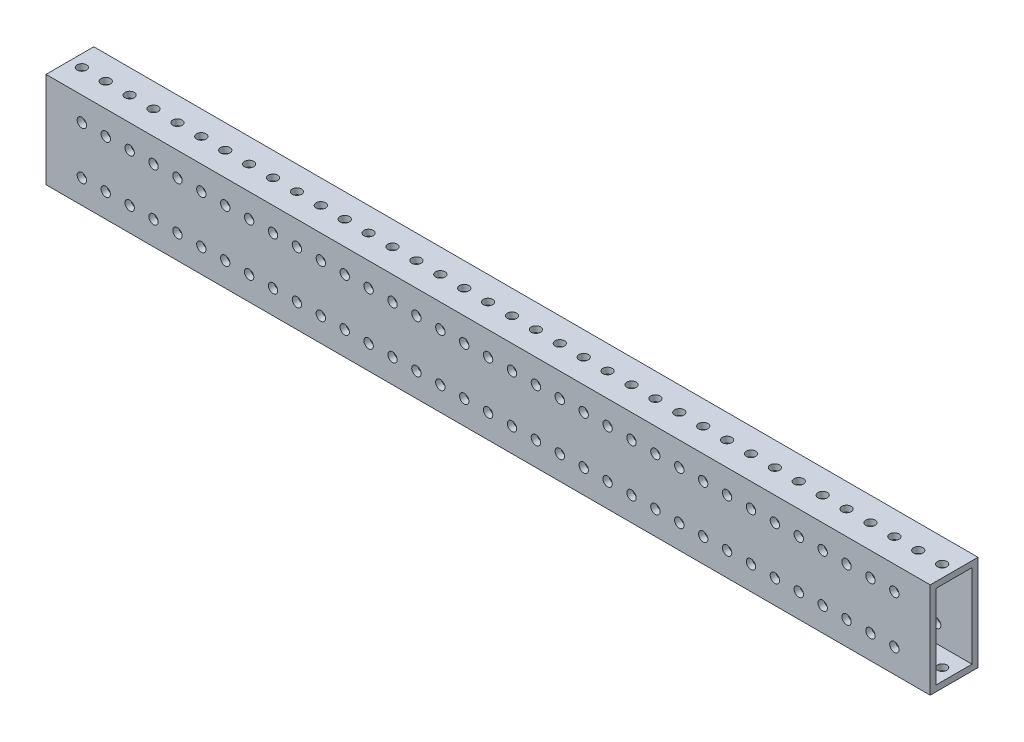
from build123d import *

# Parameters (mm, degrees)
SKETCH1_W           = 469.9
SKETCH1_H           = 50.8
BOSS_EXTRUDE1_DEPTH = 25.4
SHELL1_T            = -3.175
SKETCH2_R           = 2.4892
CUT_EXTRUDE1_DEPTH  = 25.4
SKETCH3_R           = 2.4892
CUT_EXTRUDE2_DEPTH  = 50.8


with BuildPart() as part:
    # Sketch1 → Boss-Extrude1 (new body)
    with BuildSketch(Plane.XY):
        with Locations((234.95, 25.4)):
            Rectangle(SKETCH1_W, SKETCH1_H)
    extrude(amount=BOSS_EXTRUDE1_DEPTH)

    # Shell1
    shell1_openings = [part.faces().sort_by_distance(p)[0] for p in [
        (469.9, 25.4, 12.7),
        (0, 25.4, 12.7),
    ]]
    offset(amount=SHELL1_T, openings=shell1_openings, kind=Kind.INTERSECTION)

    # Sketch2 → Cut-Extrude1 (cut)
    with BuildSketch(Plane(origin=(0, 0, 0), x_dir=(-1, 0, 0), z_dir=(0, 0, -1))):
        with Locations((-450.85, 38.1)):
            Circle(SKETCH2_R)
        with Locations((-438.15, 38.1)):
            Circle(SKETCH2_R)
        with Locations((-425.45, 38.1)):
            Circle(SKETCH2_R)
        with Locations((-412.75, 38.1)):
            Circle(SKETCH2_R)
        with Locations((-400.05, 38.1)):
            Circle(SKETCH2_R)
        with Locations((-387.35, 38.1)):
            Circle(SKETCH2_R)
        with Locations((-374.65, 38.1)):
            Circle(SKETCH2_R)
        with Locations((-361.95, 38.1)):
            Circle(SKETCH2_R)
        with Locations((-349.25, 38.1)):
            Circle(SKETCH2_R)
        with Locations((-336.55, 38.1)):
            Circle(SKETCH2_R)
        with Locations((-323.85, 38.1)):
            Circle(SKETCH2_R)
        with Locations((-311.15, 38.1)):
            Circle(SKETCH2_R)
        with Locations((-298.45, 38.1)):
            Circle(SKETCH2_R)
        with Locations((-285.75, 38.1)):
            Circle(SKETCH2_R)
        with Locations((-273.05, 38.1)):
            Circle(SKETCH2_R)
        with Locations((-260.35, 38.1)):
            Circle(SKETCH2_R)
        with Locations((-247.65, 38.1)):
            Circle(SKETCH2_R)
        with Locations((-234.95, 38.1)):
            Circle(SKETCH2_R)
        with Locations((-222.25, 38.1)):
            Circle(SKETCH2_R)
        with Locations((-209.55, 38.1)):
            Circle(SKETCH2_R)
        with Locations((-196.85, 38.1)):
            Circle(SKETCH2_R)
        with Locations((-184.15, 38.1)):
            Circle(SKETCH2_R)
        with Locations((-171.45, 38.1)):
            Circle(SKETCH2_R)
        with Locations((-158.75, 38.1)):
            Circle(SKETCH2_R)
        with Locations((-146.05, 38.1)):
            Circle(SKETCH2_R)
        with Locations((-133.35, 38.1)):
            Circle(SKETCH2_R)
        with Locations((-120.65, 38.1)):
            Circle(SKETCH2_R)
        with Locations((-107.95, 38.1)):
            Circle(SKETCH2_R)
        with Locations((-95.25, 38.1)):
            Circle(SKETCH2_R)
        with Locations((-82.55, 38.1)):
            Circle(SKETCH2_R)
        with Locations((-69.85, 38.1)):
            Circle(SKETCH2_R)
        with Locations((-57.15, 38.1)):
            Circle(SKETCH2_R)
        with Locations((-44.45, 38.1)):
            Circle(SKETCH2_R)
        with Locations((-31.75, 38.1)):
            Circle(SKETCH2_R)
        with Locations((-19.05, 38.1)):
            Circle(SKETCH2_R)
        with Locations((-438.15, 12.7)):
            Circle(SKETCH2_R)
        with Locations((-425.45, 12.7)):
            Circle(SKETCH2_R)
        with Locations((-412.75, 12.7)):
            Circle(SKETCH2_R)
        with Locations((-400.05, 12.7)):
            Circle(SKETCH2_R)
        with Locations((-387.35, 12.7)):
            Circle(SKETCH2_R)
        with Locations((-374.65, 12.7)):
            Circle(SKETCH2_R)
        with Locations((-361.95, 12.7)):
            Circle(SKETCH2_R)
        with Locations((-349.25, 12.7)):
            Circle(SKETCH2_R)
        with Locations((-336.55, 12.7)):
            Circle(SKETCH2_R)
        with Locations((-323.85, 12.7)):
            Circle(SKETCH2_R)
        with Locations((-311.15, 12.7)):
            Circle(SKETCH2_R)
        with Locations((-298.45, 12.7)):
            Circle(SKETCH2_R)
        with Locations((-285.75, 12.7)):
            Circle(SKETCH2_R)
        with Locations((-273.05, 12.7)):
            Circle(SKETCH2_R)
        with Locations((-260.35, 12.7)):
            Circle(SKETCH2_R)
        with Locations((-247.65, 12.7)):
            Circle(SKETCH2_R)
        with Locations((-234.95, 12.7)):
            Circle(SKETCH2_R)
        with Locations((-222.25, 12.7)):
            Circle(SKETCH2_R)
        with Locations((-209.55, 12.7)):
            Circle(SKETCH2_R)
        with Locations((-196.85, 12.7)):
            Circle(SKETCH2_R)
        with Locations((-184.15, 12.7)):
            Circle(SKETCH2_R)
        with Locations((-171.45, 12.7)):
            Circle(SKETCH2_R)
        with Locations((-158.75, 12.7)):
            Circle(SKETCH2_R)
        with Locations((-146.05, 12.7)):
            Circle(SKETCH2_R)
        with Locations((-133.35, 12.7)):
            Circle(SKETCH2_R)
        with Locations((-120.65, 12.7)):
            Circle(SKETCH2_R)
        with Locations((-107.95, 12.7)):
            Circle(SKETCH2_R)
        with Locations((-95.25, 12.7)):
            Circle(SKETCH2_R)
        with Locations((-82.55, 12.7)):
            Circle(SKETCH2_R)
        with Locations((-69.85, 12.7)):
            Circle(SKETCH2_R)
        with Locations((-57.15, 12.7)):
            Circle(SKETCH2_R)
        with Locations((-44.45, 12.7)):
            Circle(SKETCH2_R)
        with Locations((-31.75, 12.7)):
            Circle(SKETCH2_R)
        with Locations((-19.05, 12.7)):
            Circle(SKETCH2_R)
        with Locations((-450.85, 12.7)):
            Circle(SKETCH2_R)
    extrude(amount=-CUT_EXTRUDE1_DEPTH, mode=Mode.SUBTRACT)

    # Sketch3 → Cut-Extrude2 (cut)
    with BuildSketch(Plane(origin=(0, 50.8, 0), x_dir=(1, 0, 0), z_dir=(0, 1, 0))):
        with Locations((6.35, -12.7)):
            Circle(SKETCH3_R)
        with Locations((19.05, -12.7)):
            Circle(SKETCH3_R)
        with Locations((31.75, -12.7)):
            Circle(SKETCH3_R)
        with Locations((44.45, -12.7)):
            Circle(SKETCH3_R)
        with Locations((57.15, -12.7)):
            Circle(SKETCH3_R)
        with Locations((69.85, -12.7)):
            Circle(SKETCH3_R)
        with Locations((82.55, -12.7)):
            Circle(SKETCH3_R)
        with Locations((95.25, -12.7)):
            Circle(SKETCH3_R)
        with Locations((107.95, -12.7)):
            Circle(SKETCH3_R)
        with Locations((120.65, -12.7)):
            Circle(SKETCH3_R)
        with Locations((133.35, -12.7)):
            Circle(SKETCH3_R)
        with Locations((146.05, -12.7)):
            Circle(SKETCH3_R)
        with Locations((158.75, -12.7)):
            Circle(SKETCH3_R)
        with Locations((171.45, -12.7)):
            Circle(SKETCH3_R)
        with Locations((184.15, -12.7)):
            Circle(SKETCH3_R)
        with Locations((196.85, -12.7)):
            Circle(SKETCH3_R)
        with Locations((209.55, -12.7)):
            Circle(SKETCH3_R)
        with Locations((222.25, -12.7)):
            Circle(SKETCH3_R)
        with Locations((234.95, -12.7)):
            Circle(SKETCH3_R)
        with Locations((247.65, -12.7)):
            Circle(SKETCH3_R)
        with Locations((260.35, -12.7)):
            Circle(SKETCH3_R)
        with Locations((273.05, -12.7)):
            Circle(SKETCH3_R)
        with Locations((285.75, -12.7)):
            Circle(SKETCH3_R)
        with Locations((298.45, -12.7)):
            Circle(SKETCH3_R)
        with Locations((311.15, -12.7)):
            Circle(SKETCH3_R)
        with Locations((323.85, -12.7)):
            Circle(SKETCH3_R)
        with Locations((336.55, -12.7)):
            Circle(SKETCH3_R)
        with Locations((349.25, -12.7)):
            Circle(SKETCH3_R)
        with Locations((361.95, -12.7)):
            Circle(SKETCH3_R)
        with Locations((374.65, -12.7)):
            Circle(SKETCH3_R)
        with Locations((387.35, -12.7)):
            Circle(SKETCH3_R)
        with Locations((400.05, -12.7)):
            Circle(SKETCH3_R)
        with Locations((412.75, -12.7)):
            Circle(SKETCH3_R)
        with Locations((425.45, -12.7)):
            Circle(SKETCH3_R)
        with Locations((438.15, -12.7)):
            Circle(SKETCH3_R)
        with Locations((450.85, -12.7)):
            Circle(SKETCH3_R)
        with Locations((463.55, -12.7)):
            Circle(SKETCH3_R)
    extrude(amount=-CUT_EXTRUDE2_DEPTH, mode=Mode.SUBTRACT)


solid = part.part
